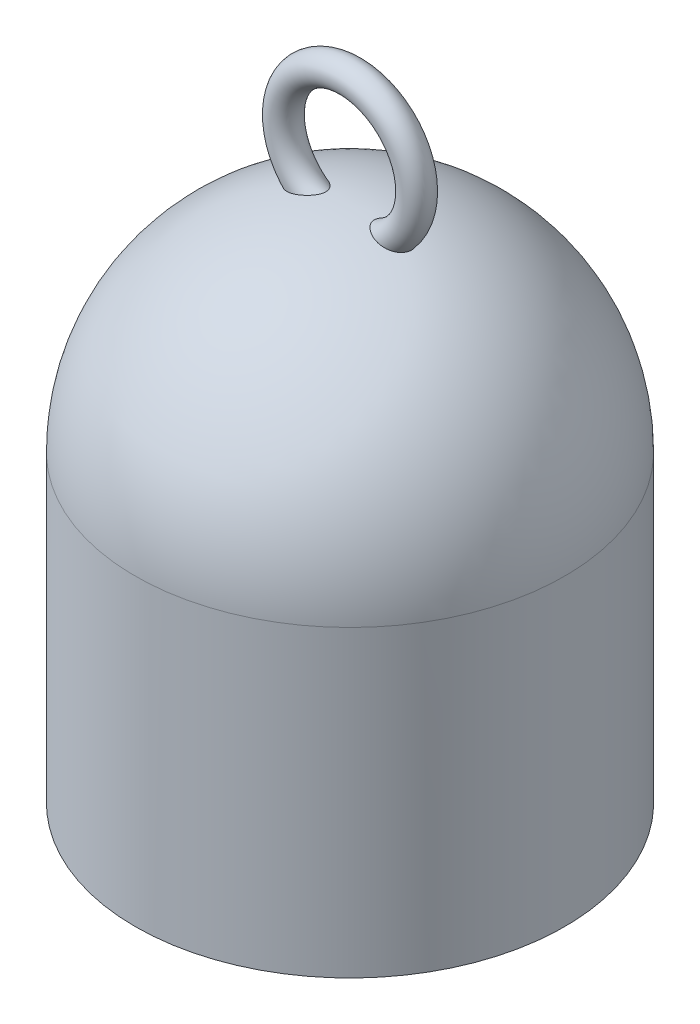
from build123d import *

# Parameters (mm, degrees)
SKETCH2_R        = 2.54
SHELL1_OUTLINE_R = 1.27
THREAD1_PITCH    = 2


with BuildPart() as part:
    # Sketch1 → Dome (revolve)
    with BuildSketch(Plane.XY):
        with BuildLine():
            Line((0, 0), (0, 88.9))
            ThreePointArc((0, 88.9), (-26.042742751, 78.112742751), (-36.83, 52.07))
            Line((-36.83, 52.07), (-36.83, 0))
            Line((-36.83, 0), (0, 0))
        make_face()
    revolve(axis=Axis((0, 0, 0), (0, 1, 0)))

    # Sketch2 → Revolve1 (revolve)
    with BuildSketch(Plane(origin=(0, 0, 0), x_dir=(0, 0, -1), z_dir=(1, 0, 0)), mode=Mode.PRIVATE) as revolve1_sk:
        with Locations((0, 85.09)):
            Circle(SKETCH2_R)
    revolve(revolve1_sk.sketch.rotate(Axis((0, 96.52, 12.671792856), (0, 0, -1)), 179.999999747), axis=Axis((0, 96.52, 12.671792856), (0, 0, -1)))

    # Shell1: read off the stored shape, not the designer's step
    # Shell1 outline → Shell1 (revolve, cut)
    with BuildSketch(Plane.XZ.offset(-96.52)):
        with Locations((11.43, 0)):
            Circle(SHELL1_OUTLINE_R)
    revolve(axis=Axis((0, 96.52, 0), (0, 0, 1)), mode=Mode.SUBTRACT)

    # Shell1 2 outline → Shell1 2 (revolve, cut)
    with BuildSketch(Plane.XY):
        with BuildLine():
            Line((35.56, 0), (35.56, 52.069999964))
            ThreePointArc((35.56, 52.069999964), (25.144717152, 77.214717126), (0, 87.63))
            Line((0, 87.63), (0, 0))
            Line((0, 0), (35.56, 0))
        make_face()
    revolve(axis=Axis((0, 0, 0), (0, 1, 0)), mode=Mode.SUBTRACT)

    # Thread1: arcs per turn and ends read off the stored shape
    # Thread1: the profile of Thread Profile1 profile screwed along a right-hand helix through 5 turns, 10 arcs to a turn; built about Z, then put on its axis
    thread1_z = Axis((0, 0, 0), (0, 0, 1))
    thread1_corners = [(35.5603, 0, -0.000173205), (35.5603, 0, 1.7501732), (34.47746825, 0, 1.124999997), (34.47746825, 0, 0.624999997)]
    with BuildLine(mode=Mode.PRIVATE) as thread1_profile:
        Line(thread1_corners[0], thread1_corners[1])
        Line(thread1_corners[1], thread1_corners[2])
        Line(thread1_corners[2], thread1_corners[3])
        Line(thread1_corners[3], thread1_corners[0])
    thread1_cap = Face(thread1_profile.wire())
    thread1_turn_angles = [0, 18, 36, 54, 72, 90, 108, 126, 144, 162, 180, 198, 216, 234, 252, 270, 288, 306, 324, 342, 360]
    thread1_turn_weights = [1, 0.9510565162951535, 1, 0.9510565162951535, 1, 0.9510565162951535, 1, 0.9510565162951535, 1, 0.9510565162951535, 1, 0.9510565162951535, 1, 0.9510565162951535, 1, 0.9510565162951535, 1, 0.9510565162951535, 1, 0.9510565162951535, 1]
    thread1_turn_rails = [Edge.make_bspline([Vector(p[0], p[1], 0).rotate(thread1_z, thread1_turn_angles[k]) / thread1_turn_weights[k] + Vector(0, 0, p[2] + THREAD1_PITCH * thread1_turn_angles[k] / 360) for k in range(21)], [0, 0, 0, 1, 1, 2, 2, 3, 3, 4, 4, 5, 5, 6, 6, 7, 7, 8, 8, 9, 9, 10, 10, 10], 2, thread1_turn_weights) for p in thread1_corners]
    thread1_turn_sides = [Face.make_surface_from_curves(thread1_turn_rails[p[0]], thread1_turn_rails[p[1]]) for p in [(0, 1), (1, 2), (2, 3), (3, 0)]]
    thread1 = Plane(origin=(0, 0, 0), x_dir=(1, 0, 0), z_dir=(0, 1, 0)) * Solid(Shell([*[p.moved(Location((0, 0, THREAD1_PITCH * i))) for i in range(5) for p in thread1_turn_sides], thread1_cap, thread1_cap.rotate(thread1_z, 1800).moved(Location((0, 0, THREAD1_PITCH * 1800 / 360)))]))
    add(thread1)


solid = part.part
